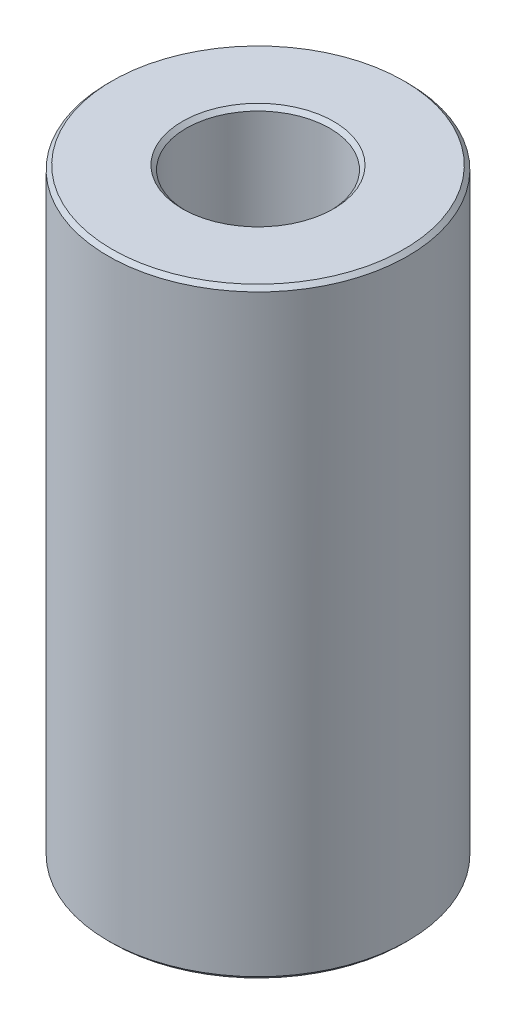
from build123d import *

# Parameters (mm, degrees)
SKETCH1_R           = 55
BOSS_EXTRUDE1_DEPTH = 220.56936055
SKETCH2_R           = 26.350495783
CUT_EXTRUDE1_DEPTH  = 234.882113069
CHAMFER1_SIZE       = 1.443983116


with BuildPart() as part:
    # Sketch1 → Boss-Extrude1 (new body)
    with BuildSketch(Plane(origin=(0, 0, 0), x_dir=(1, 0, 0), z_dir=(0, 1, 0))):
        Circle(SKETCH1_R)
    extrude(amount=BOSS_EXTRUDE1_DEPTH)

    # Sketch2 → Cut-Extrude1 (cut, through all)
    with BuildSketch(Plane(origin=(0, 0, 0), x_dir=(1, 0, 0), z_dir=(0, 1, 0))):
        Circle(SKETCH2_R)
    extrude(amount=CUT_EXTRUDE1_DEPTH, mode=Mode.SUBTRACT)

    # Chamfer1
    chamfer1_edges = [part.edges().sort_by_distance(p)[0] for p in [
        (-26.350495783, 220.56936055, 0),
        (-26.350495783, 0, 0),
        (-55, 0, 0),
        (-55, 220.56936055, 0),
    ]]
    chamfer(chamfer1_edges, length=CHAMFER1_SIZE)


solid = part.part
